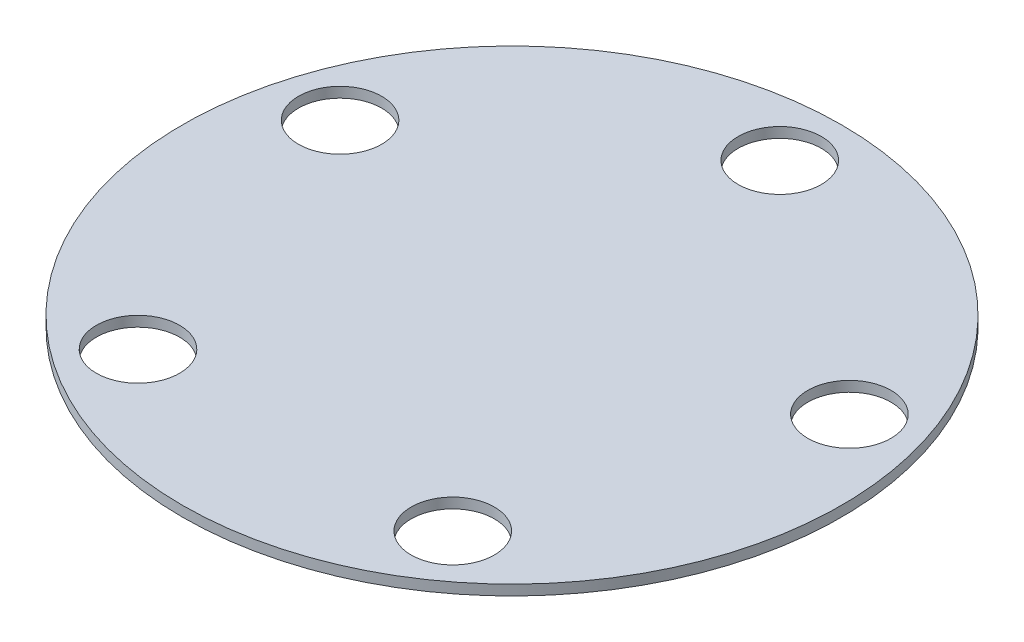
from build123d import *

# Parameters (mm, degrees)
SKETCH1_R           = 101.6
BOSS_EXTRUDE1_DEPTH = 3.175
SKETCH2_R           = 12.827
CUT_EXTRUDE1_DEPTH  = 3.175


with BuildPart() as part:
    # Sketch1 → Boss-Extrude1 (new body)
    with BuildSketch(Plane(origin=(0, 0, 0), x_dir=(1, 0, 0), z_dir=(0, 1, 0))):
        Circle(SKETCH1_R)
    extrude(amount=BOSS_EXTRUDE1_DEPTH)

    # Sketch2 → Cut-Extrude1 (cut)
    with BuildSketch(Plane(origin=(0, 3.175, 0), x_dir=(1, 0, 0), z_dir=(0, 1, 0))):
        with Locations((0, 82.55)):
            Circle(SKETCH2_R)
        with Locations((78.50971542, 25.509352886)):
            Circle(SKETCH2_R)
        with Locations((48.521672577, -66.784352886)):
            Circle(SKETCH2_R)
        with Locations((-48.521672577, -66.784352886)):
            Circle(SKETCH2_R)
        with Locations((-78.50971542, 25.509352886)):
            Circle(SKETCH2_R)
    extrude(amount=-CUT_EXTRUDE1_DEPTH, mode=Mode.SUBTRACT)


solid = part.part
